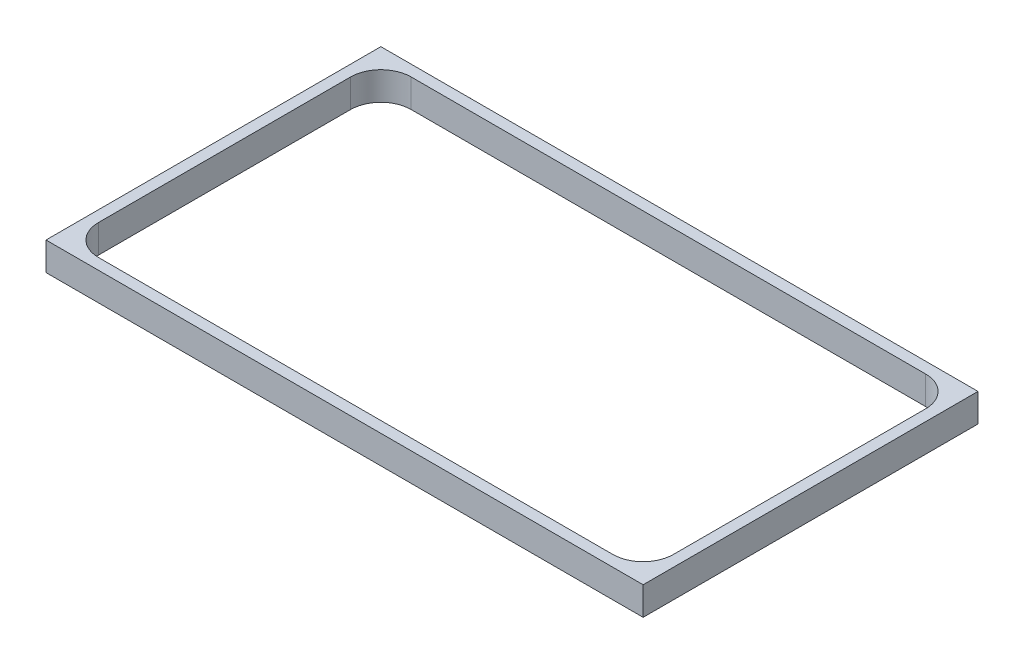
from build123d import *

# Parameters (mm, degrees)
SKETCH_1_W      = 118.4
SKETCH_1_H      = 66.4
SKETCH_1_W_2    = 114
SKETCH_1_H_2    = 62
EXTRUDE_1_DEPTH = 5.6
FILLET_3_R      = 6


with BuildPart() as part:
    # Эскиз1 → Бобышка-Вытянуть1 (new body)
    with BuildSketch(Plane(origin=(0, 0, 0), x_dir=(1, 0, 0), z_dir=(0, 1, 0))):
        with Locations((-2, 0)):
            Rectangle(SKETCH_1_W, SKETCH_1_H)
        with Locations((-2, 0)):
            Rectangle(SKETCH_1_W_2, SKETCH_1_H_2, mode=Mode.SUBTRACT)
    extrude(amount=EXTRUDE_1_DEPTH)

    # Скругление3
    fillet_3_edges = [part.edges().sort_by_distance(p)[0] for p in [
        (-59, 2.8, 31),
        (-59, 2.8, -31),
        (55, 2.8, 31),
        (55, 2.8, -31),
    ]]
    fillet(fillet_3_edges, radius=FILLET_3_R)


solid = part.part
